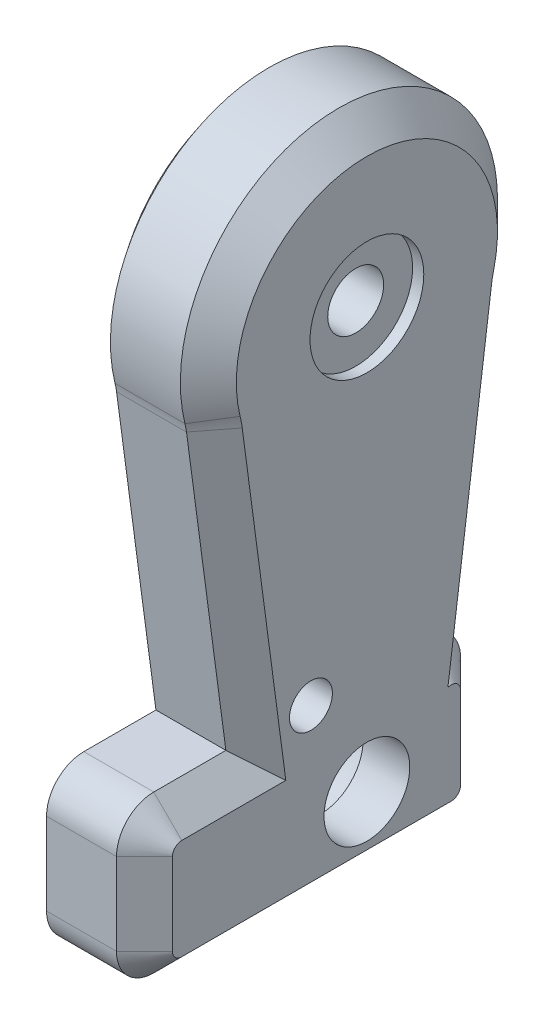
from build123d import *

# Parameters (mm, degrees)
BOSS_EXTRUDE1_START  = 65.9
BOSS_EXTRUDE1_DEPTH  = 10.5
BOSS_EXTRUDE2_START  = 65.8
BOSS_EXTRUDE2_DEPTH  = 0.6
CHAMFER1_SIZE        = 3
CHAMFER2_SIZE        = 3
BOSS_EXTRUDE3_START  = 62.7
SKETCH3_W            = 2.3
SKETCH3_H            = 23
BOSS_EXTRUDE3_DEPTH  = 6.6
BOSS_EXTRUDE4_START  = 54.5
SKETCH4_W            = 2.3
SKETCH4_H            = 6.6
BOSS_EXTRUDE4_DEPTH  = 23
BOSS_EXTRUDE5_START  = 65.9
SKETCH5_R            = 4.6
BOSS_EXTRUDE5_DEPTH  = 2.3
BOSS_EXTRUDE6_START  = 75.2
SKETCH6_R            = 6.1
BOSS_EXTRUDE6_DEPTH  = 1.7
BOSS_EXTRUDE7_START  = 68.1
SKETCH7_R            = 3
BOSS_EXTRUDE7_DEPTH  = 7.2
BOSS_EXTRUDE8_START  = 65.1
SKETCH8_W            = 6.1
SKETCH8_H            = 1.1
BOSS_EXTRUDE8_DEPTH  = 1.8
BOSS_EXTRUDE9_START  = 71.5
SKETCH9_W            = 6.1
SKETCH9_H            = 1.8
BOSS_EXTRUDE9_DEPTH  = 1.1
BOSS_EXTRUDE10_START = 65.1
SKETCH10_W           = 6.1
SKETCH10_H           = 1.1
BOSS_EXTRUDE10_DEPTH = 1.8
BOSS_EXTRUDE11_START = 59.4
SKETCH11_W           = 6.1
SKETCH11_H           = 1.8
BOSS_EXTRUDE11_DEPTH = 1.1
BOSS_EXTRUDE12_START = 65.1
SKETCH12_W           = 7.3
SKETCH12_H           = 3.4
BOSS_EXTRUDE12_DEPTH = 1.8
BOSS_EXTRUDE13_START = 72.6
SKETCH13_W           = 7.3
SKETCH13_H           = 1.8
BOSS_EXTRUDE13_DEPTH = 3.4
BOSS_EXTRUDE14_START = 65.1
SKETCH14_W           = 7.3
SKETCH14_H           = 3.4
BOSS_EXTRUDE14_DEPTH = 1.8
BOSS_EXTRUDE15_START = 56
SKETCH15_W           = 7.3
SKETCH15_H           = 1.8
BOSS_EXTRUDE15_DEPTH = 3.4
BOSS_EXTRUDE16_START = 64.4
BOSS_EXTRUDE16_DEPTH = 2.05
BOSS_EXTRUDE17_START = 55.875
SKETCH17_W           = 4.1
SKETCH17_H           = 2
BOSS_EXTRUDE17_DEPTH = 2.9
BOSS_EXTRUDE18_START = 84.025
SKETCH18_W           = 4.1
SKETCH18_H           = 2
BOSS_EXTRUDE18_DEPTH = 2.9
BOSS_EXTRUDE19_START = 59.7
SKETCH19_W           = 2.1
SKETCH19_H           = 13
BOSS_EXTRUDE19_DEPTH = 23.4
BOSS_EXTRUDE20_START = 66.3
SKETCH20_R           = 6.7
BOSS_EXTRUDE20_DEPTH = 5.1
BOSS_EXTRUDE21_START = 71.1
SKETCH21_R           = 4.6
BOSS_EXTRUDE21_DEPTH = 5.8
BOSS_EXTRUDE22_START = 63
SKETCH22_W           = 8.3
SKETCH22_H           = 20.8
BOSS_EXTRUDE22_DEPTH = 6
BOSS_EXTRUDE23_START = 70.9
SKETCH23_R           = 2.3
BOSS_EXTRUDE23_DEPTH = 6
BOSS_EXTRUDE24_START = 66.3
SKETCH24_R           = 1.3
BOSS_EXTRUDE24_DEPTH = 4.65
BOSS_EXTRUDE25_START = 57.4
SKETCH25_W           = 4.1
SKETCH25_H           = 4.1
BOSS_EXTRUDE25_DEPTH = 2.2
BOSS_EXTRUDE26_START = -47.75
BOSS_EXTRUDE26_DEPTH = 3.5
BOSS_EXTRUDE27_START = 72.4
SKETCH27_W           = 4.1
SKETCH27_H           = 4.1
BOSS_EXTRUDE27_DEPTH = 2.2
BOSS_EXTRUDE28_START = -47.75
BOSS_EXTRUDE28_DEPTH = 3.5


with BuildPart() as part:
    # Sketch1 → Boss-Extrude1 (new body)
    with BuildSketch(Plane(origin=(0, 0, 0), x_dir=(0, 0, -1), z_dir=(1, 0, 0)).offset(BOSS_EXTRUDE1_START)):
        with BuildLine():
            Line((-49.657293521, -24.929701405), (-54.04649339, -57.848700423))
            ThreePointArc((-54.04649339, -57.848700423), (-53.234221048, -59.119126346), (-52.95, -60.6))
            Line((-52.95, -60.6), (-52.95, -69.4))
            ThreePointArc((-52.95, -69.4), (-54.121572875, -72.228427125), (-56.95, -73.4))
            Line((-56.95, -73.4), (-85.85, -73.4))
            ThreePointArc((-85.85, -73.4), (-88.678427125, -72.228427125), (-89.85, -69.4))
            Line((-89.85, -69.4), (-89.85, -60.6))
            ThreePointArc((-89.85, -60.6), (-88.678427125, -57.771572875), (-85.85, -56.6))
            Line((-85.85, -56.6), (-78.12, -56.6))
            Line((-78.12, -56.6), (-82.342706479, -24.929701405))
            ThreePointArc((-82.342706479, -24.929701405), (-82.412282932, -24.49821266), (-82.505320186, -24.071167593))
            ThreePointArc((-82.505320186, -24.071167593), (-66, -3), (-49.494679814, -24.071167593))
            ThreePointArc((-49.494679814, -24.071167593), (-49.587717068, -24.49821266), (-49.657293521, -24.929701405))
        make_face()
    extrude(amount=BOSS_EXTRUDE1_DEPTH)


with BuildPart() as body_2:
    # Sketch2 → Boss-Extrude2 (new body)
    with BuildSketch(Plane(origin=(0, 0, 0), x_dir=(0, 0, -1), z_dir=(1, 0, 0)).offset(BOSS_EXTRUDE2_START)):
        with BuildLine():
            Line((-50.450275841, -24.823970429), (-54.893518409, -58.148289686))
            ThreePointArc((-54.893518409, -58.148289686), (-54.049936113, -59.247362039), (-53.75, -60.6))
            Line((-53.75, -60.6), (-53.75, -69.4))
            ThreePointArc((-53.75, -69.4), (-54.6872583, -71.6627417), (-56.95, -72.6))
            Line((-56.95, -72.6), (-85.85, -72.6))
            ThreePointArc((-85.85, -72.6), (-88.1127417, -71.6627417), (-89.05, -69.4))
            Line((-89.05, -69.4), (-89.05, -60.6))
            ThreePointArc((-89.05, -60.6), (-88.1127417, -58.3372583), (-85.85, -57.4))
            Line((-85.85, -57.4), (-77.206253549, -57.4))
            Line((-77.206253549, -57.4), (-81.549724159, -24.823970429))
            ThreePointArc((-81.549724159, -24.823970429), (-81.626258257, -24.34933281), (-81.728599236, -23.879583236))
            ThreePointArc((-81.728599236, -23.879583236), (-66, -3.8), (-50.271400764, -23.879583236))
            ThreePointArc((-50.271400764, -23.879583236), (-50.373741743, -24.34933281), (-50.450275841, -24.823970429))
        make_face()
    extrude(amount=BOSS_EXTRUDE2_DEPTH)


with BuildPart() as part_1:
    add(part.part)

    # Combine1: cut body 2
    add(body_2.part, mode=Mode.SUBTRACT)

    # Chamfer1
    chamfer1_edges = [part_1.edges().sort_by_distance(p)[0] for p in [
        (76.4, -41.389200914, 51.851893455),
        (76.4, -40.764850703, 80.23135324),
        (76.4, -24.49821266, 49.587717068),
        (76.4, -24.49821266, 82.412282932),
        (76.4, -3, 66),
    ]]
    chamfer(chamfer1_edges, length=CHAMFER1_SIZE)

    # Chamfer2
    chamfer2_edges = [part_1.edges().sort_by_distance(p)[0] for p in [
        (76.4, -56.6, 80.471725405),
        (76.4, -57.771572875, 88.678427125),
        (76.4, -57.786965833, 54.106263237),
        (76.4, -65, 89.85),
        (76.4, -65, 52.95),
        (76.4, -72.228427125, 88.678427125),
        (76.4, -72.228427125, 54.121572875),
        (76.4, -73.4, 71.4),
    ]]
    chamfer(chamfer2_edges, length=CHAMFER2_SIZE)


with BuildPart() as body_2_2:
    # Sketch3 → Boss-Extrude3 (new body)
    with BuildSketch(Plane.XY.offset(BOSS_EXTRUDE3_START)):
        with Locations((67.05, -20)):
            Rectangle(SKETCH3_W, SKETCH3_H)
    extrude(amount=BOSS_EXTRUDE3_DEPTH)


with BuildPart() as part_2:
    add(part_1.part)

    # Combine2: cut body 2 2
    add(body_2_2.part, mode=Mode.SUBTRACT)


with BuildPart() as body_2_3:
    # Sketch4 → Boss-Extrude4 (new body)
    with BuildSketch(Plane.XY.offset(BOSS_EXTRUDE4_START)):
        with Locations((67.05, -20)):
            Rectangle(SKETCH4_W, SKETCH4_H)
    extrude(amount=BOSS_EXTRUDE4_DEPTH)


with BuildPart() as part_3:
    add(part_2.part)

    # Combine3: cut body 2 3
    add(body_2_3.part, mode=Mode.SUBTRACT)


with BuildPart() as body_2_4:
    # Sketch5 → Boss-Extrude5 (new body)
    with BuildSketch(Plane(origin=(0, 0, 0), x_dir=(0, 0, -1), z_dir=(1, 0, 0)).offset(BOSS_EXTRUDE5_START)):
        with Locations((-66, -20)):
            Circle(SKETCH5_R)
    extrude(amount=BOSS_EXTRUDE5_DEPTH)


with BuildPart() as part_4:
    add(part_3.part)

    # Combine4: cut body 2 4
    add(body_2_4.part, mode=Mode.SUBTRACT)


with BuildPart() as body_2_5:
    # Sketch6 → Boss-Extrude6 (new body)
    with BuildSketch(Plane(origin=(0, 0, 0), x_dir=(0, 0, -1), z_dir=(1, 0, 0)).offset(BOSS_EXTRUDE6_START)):
        with Locations((-66, -20)):
            Circle(SKETCH6_R)
    extrude(amount=BOSS_EXTRUDE6_DEPTH)


with BuildPart() as part_5:
    add(part_4.part)

    # Combine5: cut body 2 5
    add(body_2_5.part, mode=Mode.SUBTRACT)


with BuildPart() as body_2_6:
    # Sketch7 → Boss-Extrude7 (new body)
    with BuildSketch(Plane(origin=(0, 0, 0), x_dir=(0, 0, -1), z_dir=(1, 0, 0)).offset(BOSS_EXTRUDE7_START)):
        with Locations((-66, -20)):
            Circle(SKETCH7_R)
    extrude(amount=BOSS_EXTRUDE7_DEPTH)


with BuildPart() as part_6:
    add(part_5.part)

    # Combine6: cut body 2 6
    add(body_2_6.part, mode=Mode.SUBTRACT)


with BuildPart() as body_2_7:
    # Sketch8 → Boss-Extrude8 (new body)
    with BuildSketch(Plane.XY.offset(BOSS_EXTRUDE8_START)):
        with Locations((71.15, -13.95)):
            Rectangle(SKETCH8_W, SKETCH8_H)
    extrude(amount=BOSS_EXTRUDE8_DEPTH)


with BuildPart() as part_7:
    add(part_6.part)

    # Combine7: cut body 2 7
    add(body_2_7.part, mode=Mode.SUBTRACT)


with BuildPart() as body_2_8:
    # Sketch9 → Boss-Extrude9 (new body)
    with BuildSketch(Plane.XY.offset(BOSS_EXTRUDE9_START)):
        with Locations((71.15, -20)):
            Rectangle(SKETCH9_W, SKETCH9_H)
    extrude(amount=BOSS_EXTRUDE9_DEPTH)


with BuildPart() as part_8:
    add(part_7.part)

    # Combine8: cut body 2 8
    add(body_2_8.part, mode=Mode.SUBTRACT)


with BuildPart() as body_2_9:
    # Sketch10 → Boss-Extrude10 (new body)
    with BuildSketch(Plane.XY.offset(BOSS_EXTRUDE10_START)):
        with Locations((71.15, -26.05)):
            Rectangle(SKETCH10_W, SKETCH10_H)
    extrude(amount=BOSS_EXTRUDE10_DEPTH)


with BuildPart() as part_9:
    add(part_8.part)

    # Combine9: cut body 2 9
    add(body_2_9.part, mode=Mode.SUBTRACT)


with BuildPart() as body_2_10:
    # Sketch11 → Boss-Extrude11 (new body)
    with BuildSketch(Plane.XY.offset(BOSS_EXTRUDE11_START)):
        with Locations((71.15, -20)):
            Rectangle(SKETCH11_W, SKETCH11_H)
    extrude(amount=BOSS_EXTRUDE11_DEPTH)


with BuildPart() as part_10:
    add(part_9.part)

    # Combine10: cut body 2 10
    add(body_2_10.part, mode=Mode.SUBTRACT)


with BuildPart() as body_2_11:
    # Sketch12 → Boss-Extrude12 (new body)
    with BuildSketch(Plane.XY.offset(BOSS_EXTRUDE12_START)):
        with Locations((71.75, -11.7)):
            Rectangle(SKETCH12_W, SKETCH12_H)
    extrude(amount=BOSS_EXTRUDE12_DEPTH)


with BuildPart() as part_11:
    add(part_10.part)

    # Combine11: cut body 2 11
    add(body_2_11.part, mode=Mode.SUBTRACT)


with BuildPart() as body_2_12:
    # Sketch13 → Boss-Extrude13 (new body)
    with BuildSketch(Plane.XY.offset(BOSS_EXTRUDE13_START)):
        with Locations((71.75, -20)):
            Rectangle(SKETCH13_W, SKETCH13_H)
    extrude(amount=BOSS_EXTRUDE13_DEPTH)


with BuildPart() as part_12:
    add(part_11.part)

    # Combine12: cut body 2 12
    add(body_2_12.part, mode=Mode.SUBTRACT)


with BuildPart() as body_2_13:
    # Sketch14 → Boss-Extrude14 (new body)
    with BuildSketch(Plane.XY.offset(BOSS_EXTRUDE14_START)):
        with Locations((71.75, -28.3)):
            Rectangle(SKETCH14_W, SKETCH14_H)
    extrude(amount=BOSS_EXTRUDE14_DEPTH)


with BuildPart() as part_13:
    add(part_12.part)

    # Combine13: cut body 2 13
    add(body_2_13.part, mode=Mode.SUBTRACT)


with BuildPart() as body_2_14:
    # Sketch15 → Boss-Extrude15 (new body)
    with BuildSketch(Plane.XY.offset(BOSS_EXTRUDE15_START)):
        with Locations((71.75, -20)):
            Rectangle(SKETCH15_W, SKETCH15_H)
    extrude(amount=BOSS_EXTRUDE15_DEPTH)


with BuildPart() as part_14:
    add(part_13.part)

    # Combine14: cut body 2 14
    add(body_2_14.part, mode=Mode.SUBTRACT)

    # Sketch16 → Boss-Extrude16 (add)
    with BuildSketch(Plane(origin=(0, 0, 0), x_dir=(0, 0, -1), z_dir=(1, 0, 0)).offset(BOSS_EXTRUDE16_START)):
        with BuildLine():
            Line((-51.904610688, -14.86969785), (-52.468426261, -15.074909936))
            ThreePointArc((-52.468426261, -15.074909936), (-66, -5.6), (-79.531573739, -15.074909936))
            Line((-79.531573739, -15.074909936), (-80.095389312, -14.86969785))
            ThreePointArc((-80.095389312, -14.86969785), (-66, -5), (-51.904610688, -14.86969785))
        make_face()
    extrude(amount=BOSS_EXTRUDE16_DEPTH)


with BuildPart() as body_2_15:
    # Sketch17 → Boss-Extrude17 (new body)
    with BuildSketch(Plane.XY.offset(BOSS_EXTRUDE17_START)):
        with Locations((68.35, -65)):
            Rectangle(SKETCH17_W, SKETCH17_H)
    extrude(amount=BOSS_EXTRUDE17_DEPTH)


with BuildPart() as part_15:
    add(part_14.part)

    # Combine15: cut body 2 15
    add(body_2_15.part, mode=Mode.SUBTRACT)


with BuildPart() as body_2_16:
    # Sketch18 → Boss-Extrude18 (new body)
    with BuildSketch(Plane.XY.offset(BOSS_EXTRUDE18_START)):
        with Locations((68.35, -65)):
            Rectangle(SKETCH18_W, SKETCH18_H)
    extrude(amount=BOSS_EXTRUDE18_DEPTH)


with BuildPart() as part_16:
    add(part_15.part)

    # Combine16: cut body 2 16
    add(body_2_16.part, mode=Mode.SUBTRACT)


with BuildPart() as body_2_17:
    # Sketch19 → Boss-Extrude19 (new body)
    with BuildSketch(Plane.XY.offset(BOSS_EXTRUDE19_START)):
        with Locations((67.35, -65)):
            Rectangle(SKETCH19_W, SKETCH19_H)
    extrude(amount=BOSS_EXTRUDE19_DEPTH)


with BuildPart() as part_17:
    add(part_16.part)

    # Combine17: cut body 2 17
    add(body_2_17.part, mode=Mode.SUBTRACT)


with BuildPart() as body_2_18:
    # Sketch20 → Boss-Extrude20 (new body)
    with BuildSketch(Plane(origin=(0, 0, 0), x_dir=(0, 0, -1), z_dir=(1, 0, 0)).offset(BOSS_EXTRUDE20_START)):
        with Locations((-66, -65)):
            Circle(SKETCH20_R)
    extrude(amount=BOSS_EXTRUDE20_DEPTH)


with BuildPart() as part_18:
    add(part_17.part)

    # Combine18: cut body 2 18
    add(body_2_18.part, mode=Mode.SUBTRACT)


with BuildPart() as body_2_19:
    # Sketch21 → Boss-Extrude21 (new body)
    with BuildSketch(Plane(origin=(0, 0, 0), x_dir=(0, 0, -1), z_dir=(1, 0, 0)).offset(BOSS_EXTRUDE21_START)):
        with Locations((-66, -65)):
            Circle(SKETCH21_R)
    extrude(amount=BOSS_EXTRUDE21_DEPTH)


with BuildPart() as part_19:
    add(part_18.part)

    # Combine19: cut body 2 19
    add(body_2_19.part, mode=Mode.SUBTRACT)


with BuildPart() as body_2_20:
    # Sketch22 → Boss-Extrude22 (new body)
    with BuildSketch(Plane.XY.offset(BOSS_EXTRUDE22_START)):
        with Locations((70.45, -47.4)):
            Rectangle(SKETCH22_W, SKETCH22_H)
    extrude(amount=BOSS_EXTRUDE22_DEPTH)


with BuildPart() as part_20:
    add(part_19.part)

    # Combine20: cut body 2 20
    add(body_2_20.part, mode=Mode.SUBTRACT)


with BuildPart() as body_2_21:
    # Sketch23 → Boss-Extrude23 (new body)
    with BuildSketch(Plane(origin=(0, 0, 0), x_dir=(0, 0, -1), z_dir=(1, 0, 0)).offset(BOSS_EXTRUDE23_START)):
        with Locations((-72, -54)):
            Circle(SKETCH23_R)
    extrude(amount=BOSS_EXTRUDE23_DEPTH)


with BuildPart() as part_21:
    add(part_20.part)

    # Combine21: cut body 2 21
    add(body_2_21.part, mode=Mode.SUBTRACT)


with BuildPart() as body_2_22:
    # Sketch24 → Boss-Extrude24 (new body)
    with BuildSketch(Plane(origin=(0, 0, 0), x_dir=(0, 0, -1), z_dir=(1, 0, 0)).offset(BOSS_EXTRUDE24_START)):
        with Locations((-72, -54)):
            Circle(SKETCH24_R)
    extrude(amount=BOSS_EXTRUDE24_DEPTH)


with BuildPart() as part_22:
    add(part_21.part)

    # Combine22: cut body 2 22
    add(body_2_22.part, mode=Mode.SUBTRACT)


with BuildPart() as body_2_23:
    # Sketch25 → Boss-Extrude25 (new body)
    with BuildSketch(Plane.XY.offset(BOSS_EXTRUDE25_START)):
        with Locations((68.35, -46)):
            Rectangle(SKETCH25_W, SKETCH25_H)
    extrude(amount=BOSS_EXTRUDE25_DEPTH)


with BuildPart() as part_23:
    add(part_22.part)

    # Combine23: cut body 2 23
    add(body_2_23.part, mode=Mode.SUBTRACT)

    # Sketch26 → Boss-Extrude26 (add)
    with BuildSketch(Plane(origin=(0, 0, 0), x_dir=(1, 0, 0), z_dir=(0, 1, 0)).offset(BOSS_EXTRUDE26_START)):
        Polygon((70.6, -59), (70.6, -58), (64.4, -58), (64.4, -57.6), (63.8, -57.6), (63, -58.4), (63, -59), align=None)
    extrude(amount=BOSS_EXTRUDE26_DEPTH)


with BuildPart() as body_2_24:
    # Sketch27 → Boss-Extrude27 (new body)
    with BuildSketch(Plane.XY.offset(BOSS_EXTRUDE27_START)):
        with Locations((68.35, -46)):
            Rectangle(SKETCH27_W, SKETCH27_H)
    extrude(amount=BOSS_EXTRUDE27_DEPTH)


with BuildPart() as part_24:
    add(part_23.part)

    # Combine24: cut body 2 24
    add(body_2_24.part, mode=Mode.SUBTRACT)

    # Sketch28 → Boss-Extrude28 (add)
    with BuildSketch(Plane(origin=(0, 0, 0), x_dir=(1, 0, 0), z_dir=(0, 1, 0)).offset(BOSS_EXTRUDE28_START)):
        Polygon((70.6, -73), (70.6, -74), (64.4, -74), (64.4, -74.4), (63.8, -74.4), (63, -73.6), (63, -73), align=None)
    extrude(amount=BOSS_EXTRUDE28_DEPTH)


solid = part_24.part
